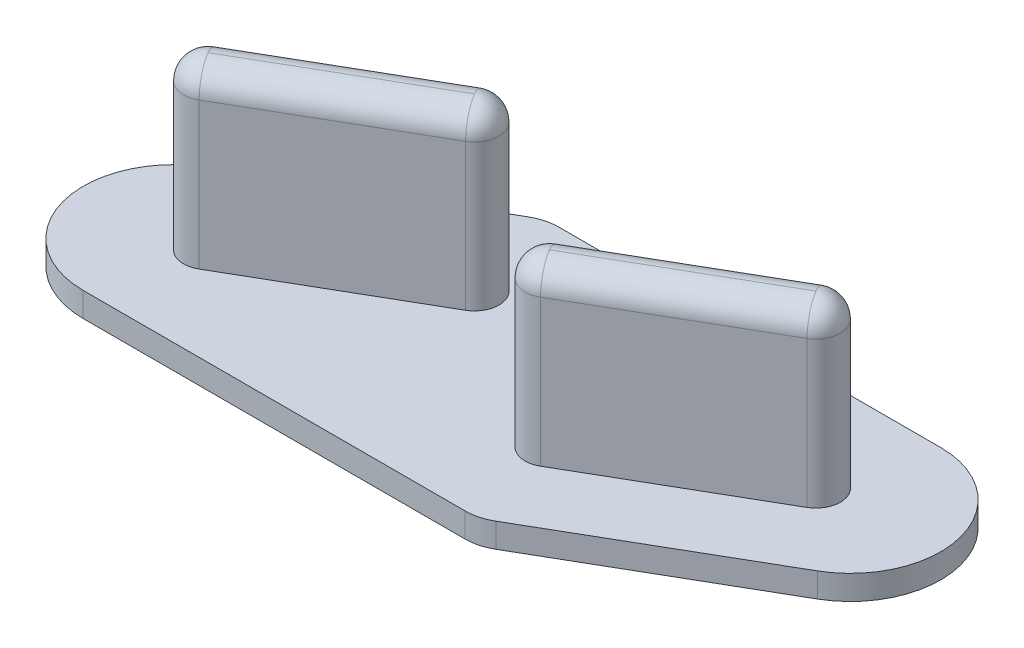
from build123d import *

# Parameters (mm, degrees)
BOSS_EXTRUDE1_DEPTH = 1
BOSS_EXTRUDE2_DEPTH = 7
LPATTERN1_COUNT     = 2
LPATTERN1_PITCH     = 14
FILLET3_R           = 1
SKETCH3_R           = 1
CUT_EXTRUDE1_DEPTH  = 29.970188425


with BuildPart() as part:
    # Sketch1 → Boss-Extrude1 (new body)
    with BuildSketch(Plane(origin=(0, 0, 0), x_dir=(1, 0, 0), z_dir=(0, 1, 0))):
        with BuildLine():
            Line((0, -3.701311317), (15.650619727, -3.701311317))
            ThreePointArc((15.650619727, -3.701311317), (16.168257817, -3.633162969), (16.650619727, -3.433362124))
            Line((16.650619727, -3.433362124), (25.008301572, 1.391947739))
            ThreePointArc((25.008301572, 1.391947739), (26.732838106, 5.555347227), (23.157645914, 8.298688683))
            Line((23.157645914, 8.298688683), (7.507026187, 8.298688683))
            ThreePointArc((7.507026187, 8.298688683), (6.989388097, 8.230540336), (6.507026187, 8.030739491))
            Line((6.507026187, 8.030739491), (-1.850655658, 3.205429628))
            ThreePointArc((-1.850655658, 3.205429628), (-3.575192192, -0.957969861), (0, -3.701311317))
        make_face()
    extrude(amount=BOSS_EXTRUDE1_DEPTH)

    # Sketch2 → Boss-Extrude2 (add)
    with BuildSketch(Plane(origin=(0, 1, 0), x_dir=(1, 0, 0), z_dir=(0, 1, 0))):
        with BuildLine():
            Line((21.542924572, 5.164714087), (14.614721342, 1.164714087))
            ThreePointArc((14.614721342, 1.164714087), (14.248695938, -0.201311317), (15.614721342, -0.567336721))
            Line((15.614721342, -0.567336721), (22.542924572, 3.432663279))
            ThreePointArc((22.542924572, 3.432663279), (22.908949976, 4.798688683), (21.542924572, 5.164714087))
        make_face()
    boss_extrude2 = extrude(amount=BOSS_EXTRUDE2_DEPTH)

    # LPattern1: Boss-Extrude2 ×2
    with Locations(*[(-i * LPATTERN1_PITCH, 0, 0) for i in range(1, LPATTERN1_COUNT)]):
        add(boss_extrude2)

    # Fillet3
    fillet3_edges = [part.edges().sort_by_distance(p)[0] for p in [
        (14.248695938, 8, 0.201311317),
        (18.078822957, 8, -3.164714087),
        (22.908949976, 8, -4.798688683),
        (19.078822957, 8, -1.432663279),
        (0.248695938, 8, 0.201311317),
        (4.078822957, 8, -3.164714087),
        (8.908949976, 8, -4.798688683),
        (5.078822957, 8, -1.432663279),
    ]]
    fillet(fillet3_edges, radius=FILLET3_R)

    # Sketch3 → Cut-Extrude1 (cut, through all)
    with BuildSketch(Plane(origin=(0, 1, 0), x_dir=(1, 0, 0), z_dir=(0, 1, 0))):
        with Locations((13.489388097, 6.298688683)):
            Circle(SKETCH3_R)
    extrude(amount=-CUT_EXTRUDE1_DEPTH, mode=Mode.SUBTRACT)


solid = part.part
